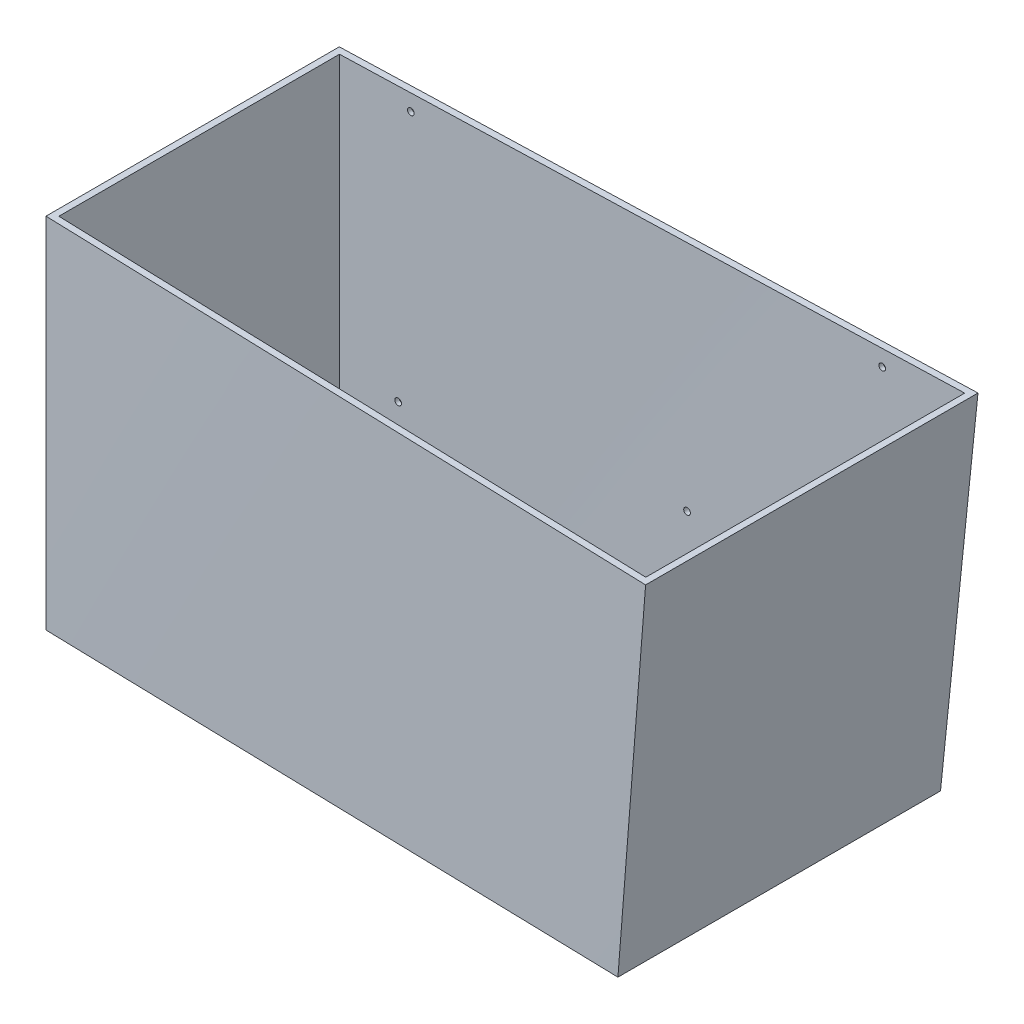
from build123d import *

# Parameters (mm, degrees)
CASCA4_T                = -10
CUT_EXTRUDE3_DEPTH      = 23
CUT_EXTRUDE3_DEPTH_BACK = 452
SKETCH3_R               = 5
CUT_EXTRUDE4_DEPTH      = 8
CUT_EXTRUDE4_DEPTH_BACK = 439
SKETCH4_R               = 5
SKETCH5_R               = 5
CUT_EXTRUDE5_DEPTH      = 55
SKETCH6_R               = 5
CUT_EXTRUDE6_DEPTH      = 56
SKETCH8_R               = 5
CUT_EXTRUDE7_DEPTH      = 20
SKETCH9_R               = 5
CUT_EXTRUDE8_DEPTH      = 20


with BuildPart() as part:
    # Esboço1 → Loft3 section 0
    with BuildSketch(Plane(origin=(0, 0, 0), x_dir=(1, 0, 0), z_dir=(0, 1, 0))):
        with BuildLine():
            Line((0, 225), (0, -225))
            Line((0, -225), (900, -247.5))
            Line((900, -247.5), (900, 247.5))
            Line((900, 247.5), (0, 225))
        make_face()
    # Esboço2 → Loft3 section 1
    with BuildSketch(Plane(origin=(0, 550, 0), x_dir=(1, 0, 0), z_dir=(0, 1, 0))):
        with BuildLine():
            Line((0, 225), (0, -225))
            Line((0, -225), (950, -255))
            Line((950, -255), (950, 255))
            Line((950, 255), (0, 225))
        make_face()
    loft()

    # Casca4
    casca4_openings = [part.faces().sort_by_distance(p)[0] for p in [
        (484.895833333, 550, 0),
    ]]
    offset(amount=CASCA4_T, openings=casca4_openings, kind=Kind.INTERSECTION)

    # Cut-Extrude1: read off the stored shape, not the designer's step
    # Cut-Extrude1: loft between two sections, ruled curve by curve
    cut_extrude1_from = [
        Edge.make_three_point_arc((121.101758385, 525.076407947, -225), (116.101758385, 530.076407947, -225), (111.101758385, 525.076407947, -225)),
        Edge.make_three_point_arc((111.101758385, 525.076407947, -225), (116.101758385, 520.076407947, -225), (121.101758385, 525.076407947, -225)),
    ]
    cut_extrude1_to = [
        Edge.make_three_point_arc((121.101758385, 525.076407947, -218.471984374), (116.101758385, 530.076407947, -218.471984374), (111.101758385, 525.076407947, -218.471984374)),
        Edge.make_three_point_arc((111.101758385, 525.076407947, -218.471984374), (116.101758385, 520.076407947, -218.471984374), (121.101758385, 525.076407947, -218.471984374)),
    ]
    cut_extrude1 = Solid(Shell([*[Face.make_surface_from_curves(cut_extrude1_from[k], cut_extrude1_to[k]) for k in range(2)], Face(Wire(cut_extrude1_from)), Face(Wire(cut_extrude1_to))]))
    add(cut_extrude1, mode=Mode.SUBTRACT)

    # Cut-Extrude1 2: loft between two sections, ruled curve by curve
    cut_extrude1_2_from = [
        Edge.make_three_point_arc((121.101758385, 525.076407947, 218.471984384), (116.101758385, 530.076407947, 218.471984384), (111.101758385, 525.076407947, 218.471984384)),
        Edge.make_three_point_arc((111.101758385, 525.076407947, 218.471984384), (116.101758385, 520.076407947, 218.471984384), (121.101758385, 525.076407947, 218.471984384)),
    ]
    cut_extrude1_2_to = [
        Edge.make_three_point_arc((121.101758385, 525.076407947, 225), (116.101758385, 530.076407947, 225), (111.101758385, 525.076407947, 225)),
        Edge.make_three_point_arc((111.101758385, 525.076407947, 225), (116.101758385, 520.076407947, 225), (121.101758385, 525.076407947, 225)),
    ]
    cut_extrude1_2 = Solid(Shell([*[Face.make_surface_from_curves(cut_extrude1_2_from[k], cut_extrude1_2_to[k]) for k in range(2)], Face(Wire(cut_extrude1_2_from)), Face(Wire(cut_extrude1_2_to))]))
    add(cut_extrude1_2, mode=Mode.SUBTRACT)

    # Cut-Extrude2: read off the stored shape, not the designer's step
    # Cut-Extrude2: loft between two sections, ruled curve by curve
    cut_extrude2_from = [
        Edge.make_three_point_arc((822.470918457, 525.465412678, -247), (817.470918457, 530.465412678, -247), (812.470918457, 525.465412678, -247)),
        Edge.make_three_point_arc((812.470918457, 525.465412678, -247), (817.470918457, 520.465412678, -247), (822.470918457, 525.465412678, -247)),
    ]
    cut_extrude2_to = [
        Edge.make_three_point_arc((822.470918457, 525.465412678, -240.418518829), (817.470918457, 530.465412678, -240.418518829), (812.470918457, 525.465412678, -240.418518829)),
        Edge.make_three_point_arc((812.470918457, 525.465412678, -240.418518829), (817.470918457, 520.465412678, -240.418518829), (822.470918457, 525.465412678, -240.418518829)),
    ]
    cut_extrude2 = Solid(Shell([*[Face.make_surface_from_curves(cut_extrude2_from[k], cut_extrude2_to[k]) for k in range(2)], Face(Wire(cut_extrude2_from)), Face(Wire(cut_extrude2_to))]))
    add(cut_extrude2, mode=Mode.SUBTRACT)

    # Cut-Extrude2 2: loft between two sections, ruled curve by curve
    cut_extrude2_2_from = [
        Edge.make_three_point_arc((822.470918457, 525.465412678, 240.418519067), (817.470918457, 530.465412678, 240.418519067), (812.470918457, 525.465412678, 240.418519067)),
        Edge.make_three_point_arc((812.470918457, 525.465412678, 240.418519067), (817.470918457, 520.465412678, 240.418519067), (822.470918457, 525.465412678, 240.418519067)),
    ]
    cut_extrude2_2_to = [
        Edge.make_three_point_arc((822.470918457, 525.465412678, 247), (817.470918457, 530.465412678, 247), (812.470918457, 525.465412678, 247)),
        Edge.make_three_point_arc((812.470918457, 525.465412678, 247), (817.470918457, 520.465412678, 247), (822.470918457, 525.465412678, 247)),
    ]
    cut_extrude2_2 = Solid(Shell([*[Face.make_surface_from_curves(cut_extrude2_2_from[k], cut_extrude2_2_to[k]) for k in range(2)], Face(Wire(cut_extrude2_2_from)), Face(Wire(cut_extrude2_2_to))]))
    add(cut_extrude2_2, mode=Mode.SUBTRACT)

    # Sketch3 → Cut-Extrude3 (cut, two sides: drawn at the far end of the back side and taken through both)
    with BuildSketch(Plane.XY.offset(215).offset(-CUT_EXTRUDE3_DEPTH_BACK)):
        with Locations((529.096415143, 195.085241143)):
            Circle(SKETCH3_R)
    extrude(amount=CUT_EXTRUDE3_DEPTH + CUT_EXTRUDE3_DEPTH_BACK, mode=Mode.SUBTRACT)

    # Sketch4 → Cut-Extrude4 (cut, two sides: drawn at the far end of the back side and taken through both)
    with BuildSketch(Plane.XY.offset(215).offset(-CUT_EXTRUDE4_DEPTH_BACK)):
        with Locations((97.648591279, 130.881920188)):
            Circle(SKETCH4_R)
    extrude(amount=CUT_EXTRUDE4_DEPTH + CUT_EXTRUDE4_DEPTH_BACK, mode=Mode.SUBTRACT)

    # Sketch5 → Cut-Extrude5 (cut)
    with BuildSketch(Plane(origin=(890, 0, 0), x_dir=(0, 0, -1), z_dir=(1, 0, 0))):
        with Locations(Location((175.040186522, 523.527338852, 0), (0, 0, 270))):
            Circle(SKETCH5_R)
    extrude(amount=CUT_EXTRUDE5_DEPTH, mode=Mode.SUBTRACT)

    # Sketch6 → Cut-Extrude6 (cut)
    with BuildSketch(Plane(origin=(890, 0, 0), x_dir=(0, 0, -1), z_dir=(1, 0, 0))):
        with Locations(Location((-174.853977213, 523.054329593, 0), (0, 0, 270))):
            Circle(SKETCH6_R)
    extrude(amount=CUT_EXTRUDE6_DEPTH, mode=Mode.SUBTRACT)

    # Sketch8 → Cut-Extrude7 (cut)
    with BuildSketch(Plane(origin=(890, 0, 0), x_dir=(0, 0, -1), z_dir=(1, 0, 0))):
        with Locations(Location((173.846443874, 154.777832346, 0), (0, 0, 270))):
            Circle(SKETCH8_R)
    extrude(amount=CUT_EXTRUDE7_DEPTH, mode=Mode.SUBTRACT)

    # Sketch9 → Cut-Extrude8 (cut)
    with BuildSketch(Plane(origin=(890, 0, 0), x_dir=(0, 0, -1), z_dir=(1, 0, 0))):
        with Locations(Location((-164.798644624, 157.991483325, 0), (0, 0, 270))):
            Circle(SKETCH9_R)
    extrude(amount=CUT_EXTRUDE8_DEPTH, mode=Mode.SUBTRACT)


solid = part.part
